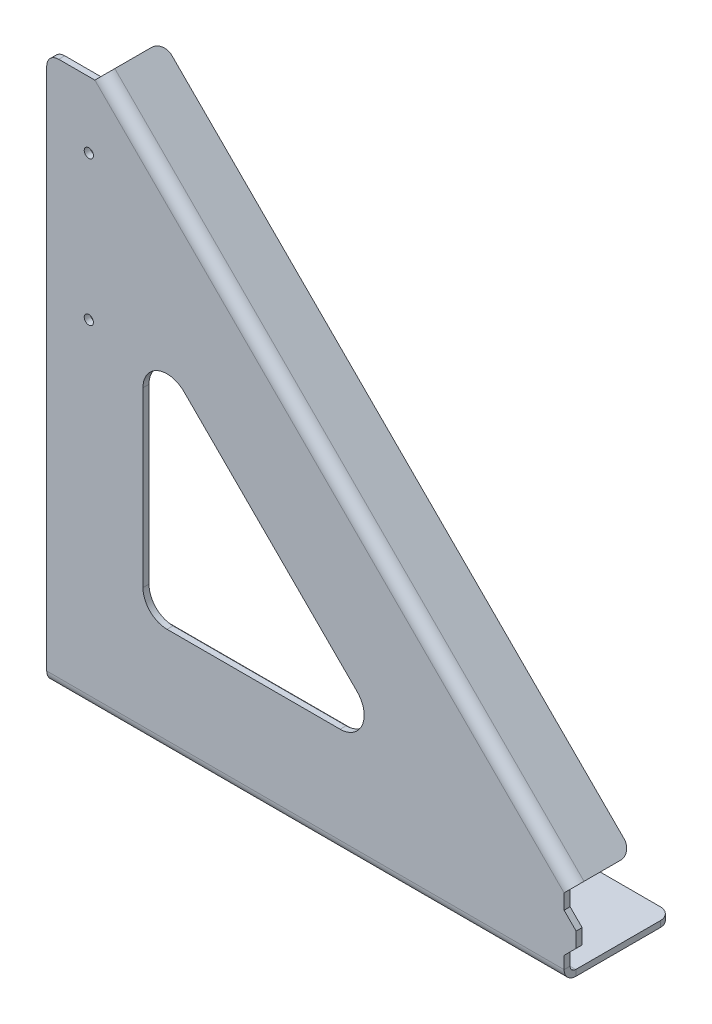
from build123d import *

# Parameters (mm, degrees)
BASE_FLANGE1_DEPTH           = 3.175
EDGE_FLANGE1_DEPTH           = 350.229988722
EDGE_FLANGE2_STRIP_W         = 18.7
EDGE_FLANGE2_STRIP_H         = 3.175
EDGE_FLANGE2_STRIP_CUT_DEPTH = 273.05
EDGE_FLANGE2_DEPTH           = 273.05
CUT_EXTRUDE1_DEPTH           = 408.732521351
FILLET1_R                    = 12.7
F_11_0_191_DIAMETER_HOLE1_D  = 4.8514
BOSS_EXTRUDE1_DEPTH          = 3.175
FILLET2_R                    = 6.35


# Sheet-metal steps are written as plain solids
with BuildPart() as part:
    # Sketch1 → Base-Flange1 (new body)
    with BuildSketch(Plane.XY):
        Polygon((0, 0), (273.05, 0), (273.05, 41.275), (25.4, 288.925), (0, 288.925), align=None)
    extrude(amount=-BASE_FLANGE1_DEPTH)

    # Edge-Flange1 section (across the edge) → Edge-Flange1 (add)
    with BuildSketch(Plane(origin=(27.521320344, 291.046320344, -3.175), x_dir=(-0.7071067811865436, -0.7071067811865516, -3.4914813388431334e-15), z_dir=(0.7071067811865516, -0.7071067811865436, 0))):
        with BuildLine():
            Line((-3.175, 3), (-3.175, 28.575))
            Line((-3.175, 28.575), (0, 28.575))
            Line((0, 28.575), (0, 3))
            ThreePointArc((0, 3), (0.878679656, 0.878679656), (3, 0))
            Line((3, 0), (3, -3.175))
            ThreePointArc((3, -3.175), (-1.366384374, -1.366384374), (-3.175, 3))
        make_face()
    extrude(amount=EDGE_FLANGE1_DEPTH)

    # Edge-Flange2 strip (across the edge) → Edge-Flange2 strip cut (cut)
    with BuildSketch(Plane(origin=(273.05, 0, -3.175), x_dir=(0, 1, 0), z_dir=(-1, 0, 0))):
        with Locations((-3.175, -1.5875)):
            Rectangle(EDGE_FLANGE2_STRIP_W, EDGE_FLANGE2_STRIP_H)
    extrude(amount=EDGE_FLANGE2_STRIP_CUT_DEPTH, mode=Mode.SUBTRACT)

    # Edge-Flange2 section (across the edge) → Edge-Flange2 (add)
    with BuildSketch(Plane(origin=(273.05, 0, -3.175), x_dir=(0, 1, 0), z_dir=(-1, 0, 0))):
        with BuildLine():
            Line((0, 3), (0, 53.975))
            Line((0, 53.975), (3.175, 53.975))
            Line((3.175, 53.975), (3.175, 3))
            ThreePointArc((3.175, 3), (4.053679656, 0.878679656), (6.175, 0))
            Line((6.175, 0), (6.175, -3.175))
            ThreePointArc((6.175, -3.175), (1.808615626, -1.366384374), (0, 3))
        make_face()
    extrude(amount=EDGE_FLANGE2_DEPTH)

    # Sketch12 → Cut-Extrude1 (cut, through all)
    with BuildSketch(Plane.XY):
        Polygon((50.8, 191.682951031), (50.8, 56.975), (185.507951031, 56.975), align=None)
    extrude(amount=-CUT_EXTRUDE1_DEPTH, mode=Mode.SUBTRACT)

    # Fillet1
    fillet1_edges = [part.edges().sort_by_distance(p)[0] for p in [
        (185.507951031, 56.975, -1.5875),
        (50.8, 56.975, -1.5875),
        (50.8, 191.682951031, -1.5875),
    ]]
    fillet(fillet1_edges, radius=FILLET1_R)

    # #11 (0.191) Diameter Hole1 (through all)
    with Locations(Plane(origin=(0, 0, -3.175), x_dir=(-1, 0, 0), z_dir=(0, 0, -1))):
        with Locations((-22.225, 254), (-22.225, 177.8)):
            Hole(F_11_0_191_DIAMETER_HOLE1_D / 2)

    # Sketch15 → Boss-Extrude1 (add)
    with BuildSketch(Plane.XY):
        Polygon((273.05, 33.3375), (279.4, 26.9875), (279.4, 19.05), (273.05, 12.7), align=None)
    extrude(amount=-BOSS_EXTRUDE1_DEPTH)

    # Fillet2
    fillet2_edges = [part.edges().sort_by_distance(p)[0] for p in [
        (28.643852359, 292.168852359, -31.75),
        (276.293852359, 44.518852359, -31.75),
        (273.05, 1.5875, -57.15),
        (0, 1.5875, -57.15),
        (0, 288.925, -1.5875),
    ]]
    fillet(fillet2_edges, radius=FILLET2_R)


solid = part.part
